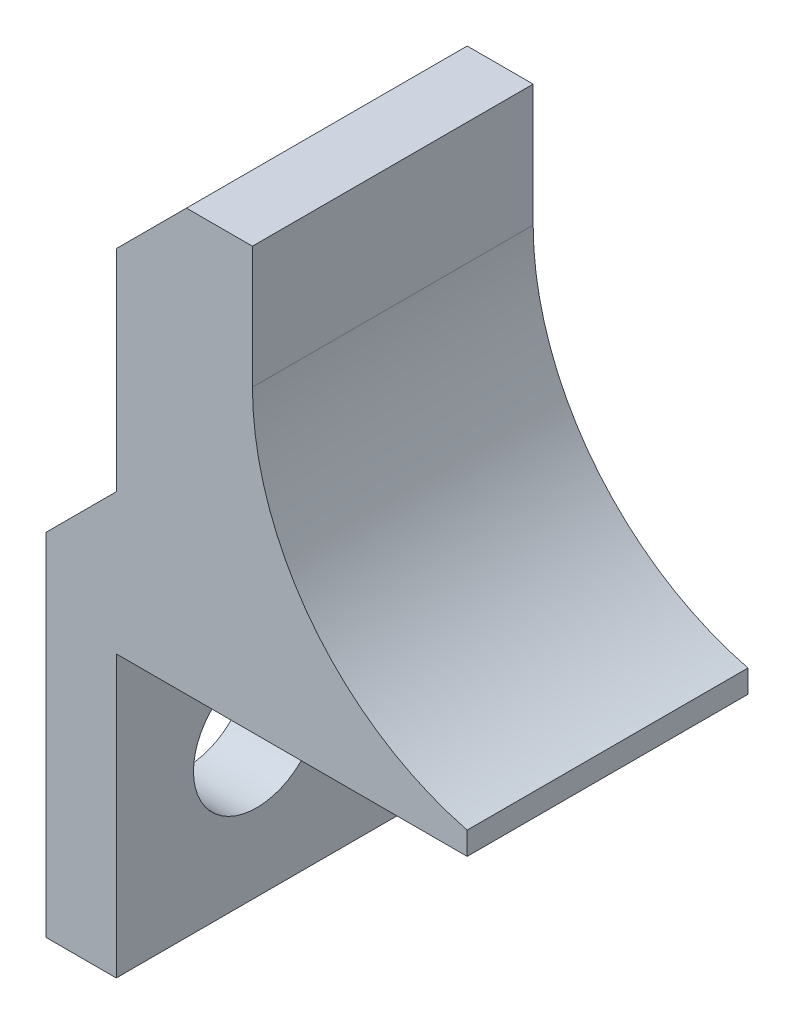
from build123d import *

# Parameters (mm, degrees)
EXTRUDE_1_DEPTH     = 20
SKETCH_3_R          = 4.5
CUT_EXTRUDE_2_DEPTH = 20
CHAMFER_1_SIZE      = 5
CHAMFER_2_SIZE      = 5


with BuildPart() as part:
    # 草图1 → 凸台-拉伸1 (new body)
    with BuildSketch(Plane.XY):
        with BuildLine():
            Line((0, 5), (0, 30))
            Line((0, 30), (9.7, 30))
            Line((9.7, 30), (9.7, 21.3))
            ThreePointArc((9.7, 21.3), (13.975175508, 8.838258549), (25, 1.625397082))
            Line((25, 1.625397082), (25, 0))
            Line((25, 0), (6.25, 0))
            Line((6.25, 0), (0, 0))
            Line((0, 0), (0, -20))
            Line((0, -20), (-5, -20))
            Line((-5, -20), (-5, 5))
            Line((-5, 5), (0, 5))
        make_face()
    extrude(amount=EXTRUDE_1_DEPTH)

    # 草图3 → 切除-拉伸2 (cut)
    with BuildSketch(Plane.ZY.offset(5)):
        with Locations((10, -10)):
            Circle(SKETCH_3_R)
    extrude(amount=-CUT_EXTRUDE_2_DEPTH, mode=Mode.SUBTRACT)

    # 倒角1
    chamfer_1_edges = [part.edges().sort_by_distance(p)[0] for p in [
        (0, 5, 10),
    ]]
    chamfer(chamfer_1_edges, length=CHAMFER_1_SIZE - 0.0001)  # a hair under: the kernel refuses the full size

    # 倒角2
    chamfer_2_edges = [part.edges().sort_by_distance(p)[0] for p in [
        (0, 30, 10),
    ]]
    chamfer(chamfer_2_edges, length=CHAMFER_2_SIZE)


solid = part.part
